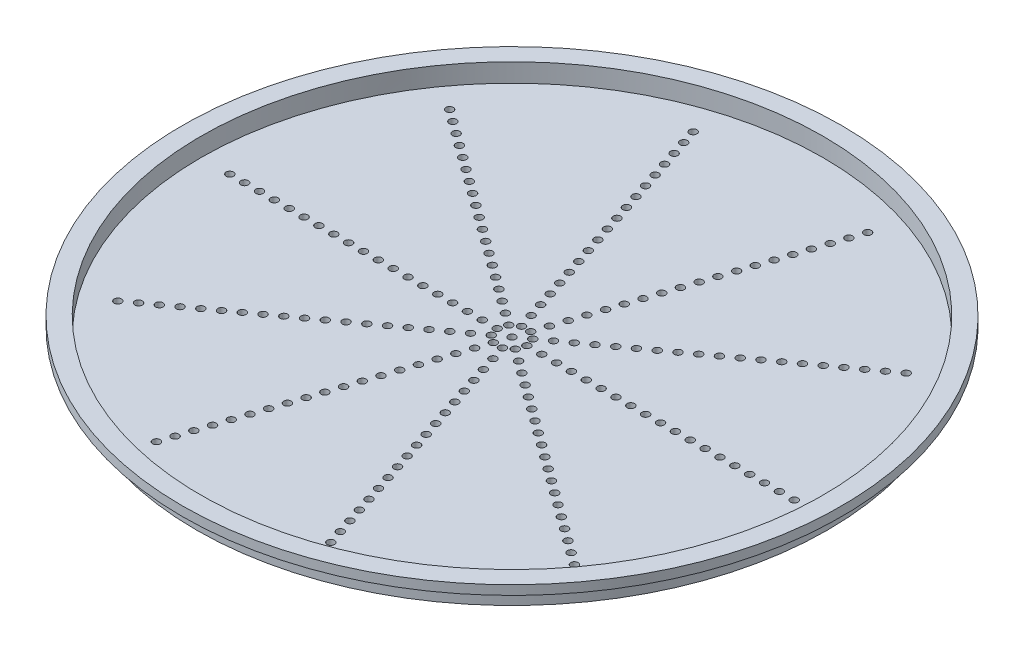
from build123d import *

# Parameters (mm, degrees)
CROQUIS1_R              = 34
SALIENTE_EXTRUIR1_DEPTH = 1
CROQUIS2_R              = 34
CROQUIS2_R_2            = 33.5
SALIENTE_EXTRUIR3_DEPTH = 3
SALIENTE_EXTRUIR4_START = -1
CROQUIS3_R              = 35.5
CROQUIS3_R_2            = 33.5
SALIENTE_EXTRUIR4_DEPTH = 1
CROQUIS5_R              = 0.4
CORTAR_EXTRUIR2_DEPTH   = 6.8


with BuildPart() as part:
    # Croquis1 → Saliente-Extruir1 (new body)
    with BuildSketch(Plane(origin=(0, 0, 0), x_dir=(1, 0, 0), z_dir=(0, 1, 0))):
        Circle(CROQUIS1_R)
    extrude(amount=SALIENTE_EXTRUIR1_DEPTH)

    # Croquis2 → Saliente-Extruir3 (add)
    with BuildSketch(Plane.XZ):
        Circle(CROQUIS2_R)
        Circle(CROQUIS2_R_2, mode=Mode.SUBTRACT)
    extrude(amount=-SALIENTE_EXTRUIR3_DEPTH)

    # Croquis3 → Saliente-Extruir4 (add)
    with BuildSketch(Plane(origin=(0, 3, 0), x_dir=(1, 0, 0), z_dir=(0, 1, 0)).offset(SALIENTE_EXTRUIR4_START)):
        Circle(CROQUIS3_R)
        Circle(CROQUIS3_R_2, mode=Mode.SUBTRACT)
    extrude(amount=SALIENTE_EXTRUIR4_DEPTH)

    # Croquis5 → Cortar-Extruir2 (cut)
    with BuildSketch(Plane(origin=(0, 1, 0), x_dir=(1, 0, 0), z_dir=(0, 1, 0))):
        Circle(CROQUIS5_R)
        with Locations((1.6, 0)):
            Circle(CROQUIS5_R)
        with Locations((3.2, 0)):
            Circle(CROQUIS5_R)
        with Locations((4.8, 0)):
            Circle(CROQUIS5_R)
        with Locations((6.4, 0)):
            Circle(CROQUIS5_R)
        with Locations((8, 0)):
            Circle(CROQUIS5_R)
        with Locations((9.6, 0)):
            Circle(CROQUIS5_R)
        with Locations((11.2, 0)):
            Circle(CROQUIS5_R)
        with Locations((12.8, 0)):
            Circle(CROQUIS5_R)
        with Locations((14.4, 0)):
            Circle(CROQUIS5_R)
        with Locations((16, 0)):
            Circle(CROQUIS5_R)
        with Locations((17.6, 0)):
            Circle(CROQUIS5_R)
        with Locations((19.2, 0)):
            Circle(CROQUIS5_R)
        with Locations((20.8, 0)):
            Circle(CROQUIS5_R)
        with Locations((22.4, 0)):
            Circle(CROQUIS5_R)
        with Locations((24, 0)):
            Circle(CROQUIS5_R)
        with Locations((25.6, 0)):
            Circle(CROQUIS5_R)
        with Locations((27.2, 0)):
            Circle(CROQUIS5_R)
        with Locations((28.8, 0)):
            Circle(CROQUIS5_R)
        with Locations((30.4, 0)):
            Circle(CROQUIS5_R)
        with Locations((1.294427191, -0.940456404)):
            Circle(CROQUIS5_R)
        with Locations((2.588854382, -1.880912807)):
            Circle(CROQUIS5_R)
        with Locations((3.883281573, -2.821369211)):
            Circle(CROQUIS5_R)
        with Locations((5.177708764, -3.761825615)):
            Circle(CROQUIS5_R)
        with Locations((6.472135955, -4.702282018)):
            Circle(CROQUIS5_R)
        with Locations((7.766563146, -5.642738422)):
            Circle(CROQUIS5_R)
        with Locations((9.060990337, -6.583194826)):
            Circle(CROQUIS5_R)
        with Locations((10.355417528, -7.523651229)):
            Circle(CROQUIS5_R)
        with Locations((11.649844719, -8.464107633)):
            Circle(CROQUIS5_R)
        with Locations((12.94427191, -9.404564037)):
            Circle(CROQUIS5_R)
        with Locations((14.238699101, -10.34502044)):
            Circle(CROQUIS5_R)
        with Locations((15.533126292, -11.285476844)):
            Circle(CROQUIS5_R)
        with Locations((16.827553483, -12.225933248)):
            Circle(CROQUIS5_R)
        with Locations((18.121980674, -13.166389651)):
            Circle(CROQUIS5_R)
        with Locations((19.416407865, -14.106846055)):
            Circle(CROQUIS5_R)
        with Locations((20.710835056, -15.047302459)):
            Circle(CROQUIS5_R)
        with Locations((22.005262247, -15.987758862)):
            Circle(CROQUIS5_R)
        with Locations((23.299689438, -16.928215266)):
            Circle(CROQUIS5_R)
        with Locations((24.594116629, -17.86867167)):
            Circle(CROQUIS5_R)
        with Locations((0.494427191, -1.521690426)):
            Circle(CROQUIS5_R)
        with Locations((0.988854382, -3.043380852)):
            Circle(CROQUIS5_R)
        with Locations((1.483281573, -4.565071278)):
            Circle(CROQUIS5_R)
        with Locations((1.977708764, -6.086761704)):
            Circle(CROQUIS5_R)
        with Locations((2.472135955, -7.60845213)):
            Circle(CROQUIS5_R)
        with Locations((2.966563146, -9.130142556)):
            Circle(CROQUIS5_R)
        with Locations((3.460990337, -10.651832983)):
            Circle(CROQUIS5_R)
        with Locations((3.955417528, -12.173523409)):
            Circle(CROQUIS5_R)
        with Locations((4.449844719, -13.695213835)):
            Circle(CROQUIS5_R)
        with Locations((4.94427191, -15.216904261)):
            Circle(CROQUIS5_R)
        with Locations((5.438699101, -16.738594687)):
            Circle(CROQUIS5_R)
        with Locations((5.933126292, -18.260285113)):
            Circle(CROQUIS5_R)
        with Locations((6.427553483, -19.781975539)):
            Circle(CROQUIS5_R)
        with Locations((6.921980674, -21.303665965)):
            Circle(CROQUIS5_R)
        with Locations((7.416407865, -22.825356391)):
            Circle(CROQUIS5_R)
        with Locations((7.910835056, -24.347046817)):
            Circle(CROQUIS5_R)
        with Locations((8.405262247, -25.868737243)):
            Circle(CROQUIS5_R)
        with Locations((8.899689438, -27.390427669)):
            Circle(CROQUIS5_R)
        with Locations((9.394116629, -28.912118095)):
            Circle(CROQUIS5_R)
        with Locations((-0.494427191, -1.521690426)):
            Circle(CROQUIS5_R)
        with Locations((-0.988854382, -3.043380852)):
            Circle(CROQUIS5_R)
        with Locations((-1.483281573, -4.565071278)):
            Circle(CROQUIS5_R)
        with Locations((-1.977708764, -6.086761704)):
            Circle(CROQUIS5_R)
        with Locations((-2.472135955, -7.60845213)):
            Circle(CROQUIS5_R)
        with Locations((-2.966563146, -9.130142556)):
            Circle(CROQUIS5_R)
        with Locations((-3.460990337, -10.651832983)):
            Circle(CROQUIS5_R)
        with Locations((-3.955417528, -12.173523409)):
            Circle(CROQUIS5_R)
        with Locations((-4.449844719, -13.695213835)):
            Circle(CROQUIS5_R)
        with Locations((-4.94427191, -15.216904261)):
            Circle(CROQUIS5_R)
        with Locations((-5.438699101, -16.738594687)):
            Circle(CROQUIS5_R)
        with Locations((-5.933126292, -18.260285113)):
            Circle(CROQUIS5_R)
        with Locations((-6.427553483, -19.781975539)):
            Circle(CROQUIS5_R)
        with Locations((-6.921980674, -21.303665965)):
            Circle(CROQUIS5_R)
        with Locations((-7.416407865, -22.825356391)):
            Circle(CROQUIS5_R)
        with Locations((-7.910835056, -24.347046817)):
            Circle(CROQUIS5_R)
        with Locations((-8.405262247, -25.868737243)):
            Circle(CROQUIS5_R)
        with Locations((-8.899689438, -27.390427669)):
            Circle(CROQUIS5_R)
        with Locations((-9.394116629, -28.912118095)):
            Circle(CROQUIS5_R)
        with Locations((-1.294427191, -0.940456404)):
            Circle(CROQUIS5_R)
        with Locations((-2.588854382, -1.880912807)):
            Circle(CROQUIS5_R)
        with Locations((-3.883281573, -2.821369211)):
            Circle(CROQUIS5_R)
        with Locations((-5.177708764, -3.761825615)):
            Circle(CROQUIS5_R)
        with Locations((-6.472135955, -4.702282018)):
            Circle(CROQUIS5_R)
        with Locations((-7.766563146, -5.642738422)):
            Circle(CROQUIS5_R)
        with Locations((-9.060990337, -6.583194826)):
            Circle(CROQUIS5_R)
        with Locations((-10.355417528, -7.523651229)):
            Circle(CROQUIS5_R)
        with Locations((-11.649844719, -8.464107633)):
            Circle(CROQUIS5_R)
        with Locations((-12.94427191, -9.404564037)):
            Circle(CROQUIS5_R)
        with Locations((-14.238699101, -10.34502044)):
            Circle(CROQUIS5_R)
        with Locations((-15.533126292, -11.285476844)):
            Circle(CROQUIS5_R)
        with Locations((-16.827553483, -12.225933248)):
            Circle(CROQUIS5_R)
        with Locations((-18.121980674, -13.166389651)):
            Circle(CROQUIS5_R)
        with Locations((-19.416407865, -14.106846055)):
            Circle(CROQUIS5_R)
        with Locations((-20.710835056, -15.047302459)):
            Circle(CROQUIS5_R)
        with Locations((-22.005262247, -15.987758862)):
            Circle(CROQUIS5_R)
        with Locations((-23.299689438, -16.928215266)):
            Circle(CROQUIS5_R)
        with Locations((-24.594116629, -17.86867167)):
            Circle(CROQUIS5_R)
        with Locations((-1.6, 0)):
            Circle(CROQUIS5_R)
        with Locations((-3.2, 0)):
            Circle(CROQUIS5_R)
        with Locations((-4.8, 0)):
            Circle(CROQUIS5_R)
        with Locations((-6.4, 0)):
            Circle(CROQUIS5_R)
        with Locations((-8, 0)):
            Circle(CROQUIS5_R)
        with Locations((-9.6, 0)):
            Circle(CROQUIS5_R)
        with Locations((-11.2, 0)):
            Circle(CROQUIS5_R)
        with Locations((-12.8, 0)):
            Circle(CROQUIS5_R)
        with Locations((-14.4, 0)):
            Circle(CROQUIS5_R)
        with Locations((-16, 0)):
            Circle(CROQUIS5_R)
        with Locations((-17.6, 0)):
            Circle(CROQUIS5_R)
        with Locations((-19.2, 0)):
            Circle(CROQUIS5_R)
        with Locations((-20.8, 0)):
            Circle(CROQUIS5_R)
        with Locations((-22.4, 0)):
            Circle(CROQUIS5_R)
        with Locations((-24, 0)):
            Circle(CROQUIS5_R)
        with Locations((-25.6, 0)):
            Circle(CROQUIS5_R)
        with Locations((-27.2, 0)):
            Circle(CROQUIS5_R)
        with Locations((-28.8, 0)):
            Circle(CROQUIS5_R)
        with Locations((-30.4, 0)):
            Circle(CROQUIS5_R)
        with Locations((-1.294427191, 0.940456404)):
            Circle(CROQUIS5_R)
        with Locations((-2.588854382, 1.880912807)):
            Circle(CROQUIS5_R)
        with Locations((-3.883281573, 2.821369211)):
            Circle(CROQUIS5_R)
        with Locations((-5.177708764, 3.761825615)):
            Circle(CROQUIS5_R)
        with Locations((-6.472135955, 4.702282018)):
            Circle(CROQUIS5_R)
        with Locations((-7.766563146, 5.642738422)):
            Circle(CROQUIS5_R)
        with Locations((-9.060990337, 6.583194826)):
            Circle(CROQUIS5_R)
        with Locations((-10.355417528, 7.523651229)):
            Circle(CROQUIS5_R)
        with Locations((-11.649844719, 8.464107633)):
            Circle(CROQUIS5_R)
        with Locations((-12.94427191, 9.404564037)):
            Circle(CROQUIS5_R)
        with Locations((-14.238699101, 10.34502044)):
            Circle(CROQUIS5_R)
        with Locations((-15.533126292, 11.285476844)):
            Circle(CROQUIS5_R)
        with Locations((-16.827553483, 12.225933248)):
            Circle(CROQUIS5_R)
        with Locations((-18.121980674, 13.166389651)):
            Circle(CROQUIS5_R)
        with Locations((-19.416407865, 14.106846055)):
            Circle(CROQUIS5_R)
        with Locations((-20.710835056, 15.047302459)):
            Circle(CROQUIS5_R)
        with Locations((-22.005262247, 15.987758862)):
            Circle(CROQUIS5_R)
        with Locations((-23.299689438, 16.928215266)):
            Circle(CROQUIS5_R)
        with Locations((-24.594116629, 17.86867167)):
            Circle(CROQUIS5_R)
        with Locations((-0.494427191, 1.521690426)):
            Circle(CROQUIS5_R)
        with Locations((-0.988854382, 3.043380852)):
            Circle(CROQUIS5_R)
        with Locations((-1.483281573, 4.565071278)):
            Circle(CROQUIS5_R)
        with Locations((-1.977708764, 6.086761704)):
            Circle(CROQUIS5_R)
        with Locations((-2.472135955, 7.60845213)):
            Circle(CROQUIS5_R)
        with Locations((-2.966563146, 9.130142556)):
            Circle(CROQUIS5_R)
        with Locations((-3.460990337, 10.651832983)):
            Circle(CROQUIS5_R)
        with Locations((-3.955417528, 12.173523409)):
            Circle(CROQUIS5_R)
        with Locations((-4.449844719, 13.695213835)):
            Circle(CROQUIS5_R)
        with Locations((-4.94427191, 15.216904261)):
            Circle(CROQUIS5_R)
        with Locations((-5.438699101, 16.738594687)):
            Circle(CROQUIS5_R)
        with Locations((-5.933126292, 18.260285113)):
            Circle(CROQUIS5_R)
        with Locations((-6.427553483, 19.781975539)):
            Circle(CROQUIS5_R)
        with Locations((-6.921980674, 21.303665965)):
            Circle(CROQUIS5_R)
        with Locations((-7.416407865, 22.825356391)):
            Circle(CROQUIS5_R)
        with Locations((-7.910835056, 24.347046817)):
            Circle(CROQUIS5_R)
        with Locations((-8.405262247, 25.868737243)):
            Circle(CROQUIS5_R)
        with Locations((-8.899689438, 27.390427669)):
            Circle(CROQUIS5_R)
        with Locations((-9.394116629, 28.912118095)):
            Circle(CROQUIS5_R)
        with Locations((0.494427191, 1.521690426)):
            Circle(CROQUIS5_R)
        with Locations((0.988854382, 3.043380852)):
            Circle(CROQUIS5_R)
        with Locations((1.483281573, 4.565071278)):
            Circle(CROQUIS5_R)
        with Locations((1.977708764, 6.086761704)):
            Circle(CROQUIS5_R)
        with Locations((2.472135955, 7.60845213)):
            Circle(CROQUIS5_R)
        with Locations((2.966563146, 9.130142556)):
            Circle(CROQUIS5_R)
        with Locations((3.460990337, 10.651832983)):
            Circle(CROQUIS5_R)
        with Locations((3.955417528, 12.173523409)):
            Circle(CROQUIS5_R)
        with Locations((4.449844719, 13.695213835)):
            Circle(CROQUIS5_R)
        with Locations((4.94427191, 15.216904261)):
            Circle(CROQUIS5_R)
        with Locations((5.438699101, 16.738594687)):
            Circle(CROQUIS5_R)
        with Locations((5.933126292, 18.260285113)):
            Circle(CROQUIS5_R)
        with Locations((6.427553483, 19.781975539)):
            Circle(CROQUIS5_R)
        with Locations((6.921980674, 21.303665965)):
            Circle(CROQUIS5_R)
        with Locations((7.416407865, 22.825356391)):
            Circle(CROQUIS5_R)
        with Locations((7.910835056, 24.347046817)):
            Circle(CROQUIS5_R)
        with Locations((8.405262247, 25.868737243)):
            Circle(CROQUIS5_R)
        with Locations((8.899689438, 27.390427669)):
            Circle(CROQUIS5_R)
        with Locations((9.394116629, 28.912118095)):
            Circle(CROQUIS5_R)
        with Locations((1.294427191, 0.940456404)):
            Circle(CROQUIS5_R)
        with Locations((2.588854382, 1.880912807)):
            Circle(CROQUIS5_R)
        with Locations((3.883281573, 2.821369211)):
            Circle(CROQUIS5_R)
        with Locations((5.177708764, 3.761825615)):
            Circle(CROQUIS5_R)
        with Locations((6.472135955, 4.702282018)):
            Circle(CROQUIS5_R)
        with Locations((7.766563146, 5.642738422)):
            Circle(CROQUIS5_R)
        with Locations((9.060990337, 6.583194826)):
            Circle(CROQUIS5_R)
        with Locations((10.355417528, 7.523651229)):
            Circle(CROQUIS5_R)
        with Locations((11.649844719, 8.464107633)):
            Circle(CROQUIS5_R)
        with Locations((12.94427191, 9.404564037)):
            Circle(CROQUIS5_R)
        with Locations((14.238699101, 10.34502044)):
            Circle(CROQUIS5_R)
        with Locations((15.533126292, 11.285476844)):
            Circle(CROQUIS5_R)
        with Locations((16.827553483, 12.225933248)):
            Circle(CROQUIS5_R)
        with Locations((18.121980674, 13.166389651)):
            Circle(CROQUIS5_R)
        with Locations((19.416407865, 14.106846055)):
            Circle(CROQUIS5_R)
        with Locations((20.710835056, 15.047302459)):
            Circle(CROQUIS5_R)
        with Locations((22.005262247, 15.987758862)):
            Circle(CROQUIS5_R)
        with Locations((23.299689438, 16.928215266)):
            Circle(CROQUIS5_R)
        with Locations((24.594116629, 17.86867167)):
            Circle(CROQUIS5_R)
    extrude(amount=-CORTAR_EXTRUIR2_DEPTH, mode=Mode.SUBTRACT)


solid = part.part
